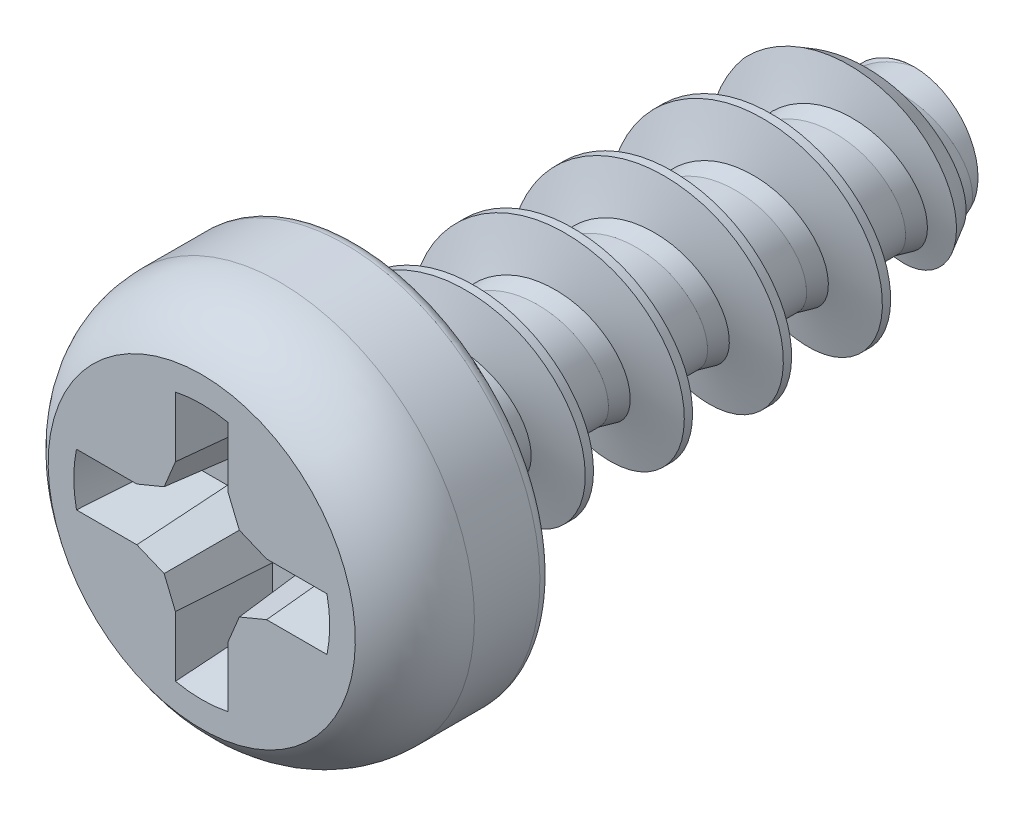
from build123d import *

# Parameters (mm, degrees)
CUT_EXTRUDE1_DEPTH      = 0.8
CIRPATTERN1_COUNT       = 4
DRAFT2_ANGLE            = 5
FILLET1_R               = 0.11125
SWEEP2_PITCH            = 0.89
CUT_EXTRUDE4_DEPTH      = 7.947736046
CUT_EXTRUDE4_DEPTH_BACK = 7.947736046
SKETCH16_W              = 1.4
SKETCH16_H              = 3.5
SKETCH16_W_2            = 2.225
SKETCH14_R              = 1
BOSS_EXTRUDE3_DEPTH     = 0.25
SKETCH15_R              = 1
BOSS_EXTRUDE4_DEPTH     = 0.75
BOSS_EXTRUDE4_DRAFT     = -39


# Read off the part's stored shape, not the designer's step: Draft1
with BuildPart() as part:
    # Sketch3 → Revolve1 (revolve)
    with BuildSketch(Plane(origin=(0, 0, 0), x_dir=(0, 0, -1), z_dir=(1, 0, 0)), mode=Mode.PRIVATE) as revolve1_sk:
        Polygon((0, 0.575), (0, 1.75), (-1.4, 1.75), (-1.4, 0), (5, 0), (5, 0.575), align=None)
    revolve(revolve1_sk.sketch.rotate(Axis((0, 0, 1.4), (0, 0, -1)), 180), axis=Axis((0, 0, 1.4), (0, 0, -1)))

    # Sketch4 → Cut-Revolve1 (revolve, cut)
    with BuildSketch(Plane(origin=(0, 0, 0), x_dir=(0, 0, -1), z_dir=(1, 0, 0)), mode=Mode.PRIVATE) as cut_revolve1_sk:
        with BuildLine():
            Line((-1.4, 1.38), (-1.6, 1.38))
            Line((-1.6, 1.38), (-1.6, 1.95))
            Line((-1.6, 1.95), (0, 1.95))
            Line((0, 1.95), (0, 1.75))
            Line((0, 1.75), (-0.7, 1.75))
            ThreePointArc((-0.7, 1.75), (-1.095885084, 1.651809619), (-1.4, 1.38))
        make_face()
    revolve(cut_revolve1_sk.sketch.rotate(Axis((0, 0, 0), (0, 0, 1)), 180), axis=Axis((0, 0, 0), (0, 0, 1)), mode=Mode.SUBTRACT)

    # Sketch5 → Cut-Extrude1 (cut)
    with BuildSketch(Plane.XY.offset(1.4)):
        with BuildLine():
            Line((0, 1.15), (0, 0))
            Line((0, 0), (1.15, 0))
            ThreePointArc((1.15, 0), (1.146975915, 0.083344165), (1.137919565, 0.16625))
            Line((1.137919565, 0.16625), (0.568959783, 0.16625))
            Line((0.568959783, 0.16625), (0.284200965, 0.284200965))
            Line((0.284200965, 0.284200965), (0.16625, 0.568959783))
            Line((0.16625, 0.568959783), (0.16625, 1.137919565))
            ThreePointArc((0.16625, 1.137919565), (0.083344165, 1.146975915), (0, 1.15))
        make_face()
    cut_extrude1 = extrude(amount=-CUT_EXTRUDE1_DEPTH, mode=Mode.SUBTRACT)

    # CirPattern1: Cut-Extrude1 ×4 about axis
    cirpattern1_axis = Axis((0, 0, 0), (0, 0, 1))
    for i in range(1, CIRPATTERN1_COUNT):
        add(cut_extrude1.rotate(cirpattern1_axis, i * 360 / CIRPATTERN1_COUNT), mode=Mode.SUBTRACT)

    # Draft1 outline → Draft1 (revolve)
    with BuildSketch(Plane.XZ):
        Polygon((1.15, 1.4), (1.008938415, 0.6), (1.15, 0.6), align=None)
    revolve(axis=Axis((0, 0, 0), (0, 0, 1)))

    # Draft2
    draft2_faces = [part.faces().sort_by_distance(p)[0] for p in [
        (0.16625, 0.819472282, 1.019127298),
        (0.225225482, 0.426580374, 1),
        (0.426580374, 0.225225482, 1),
        (0.819472282, 0.16625, 1.019127298),
        (0.819472282, -0.16625, 1.019127298),
        (0.426580374, -0.225225482, 1),
        (0.225225482, -0.426580374, 1),
        (0.16625, -0.819472282, 1.019127298),
        (-0.16625, -0.819472282, 1.019127298),
        (-0.225225482, -0.426580374, 1),
        (-0.426580374, -0.225225482, 1),
        (-0.819472282, -0.16625, 1.019127298),
        (-0.819472282, 0.16625, 1.019127298),
        (-0.426580374, 0.225225482, 1),
        (-0.225225482, 0.426580374, 1),
        (-0.16625, 0.819472282, 1.019127298),
    ]]
    draft(draft2_faces, Plane.XY.offset(0.6), DRAFT2_ANGLE)

    # Fillet1
    fillet1_edges = [part.edges().sort_by_distance(p)[0] for p in [
        (0, 1.75, 0),
    ]]
    fillet(fillet1_edges, radius=FILLET1_R)


with BuildPart() as body_2:
    # Split1: the piece on the far side of the plane
    add(part.part)
    split(bisect_by=Plane.XY, keep=Keep.BOTTOM)

    # Sweep2: the profile of Sketch9 screwed along a right-hand helix of 7.617978 turns, 8 arcs to a turn; built about Z, then put on its axis
    sweep2_z = Axis((0, 0, 0), (0, 0, 1))
    sweep2_corners = [(1, 0, -0.263915531), (1, 0, -0.338082198), (0.612083333, 0, -0.442024155), (0.575, 0, -0.601997729), (0.421928043, 0, -0.601997729), (0.421928043, 0, 0), (0.575, 0, 0), (0.612083333, 0, -0.159973574)]
    with BuildLine(mode=Mode.PRIVATE) as sweep2_profile:
        Line(sweep2_corners[0], sweep2_corners[1])
        Line(sweep2_corners[1], sweep2_corners[2])
        Line(sweep2_corners[2], sweep2_corners[3])
        Line(sweep2_corners[3], sweep2_corners[4])
        Line(sweep2_corners[4], sweep2_corners[5])
        Line(sweep2_corners[5], sweep2_corners[6])
        Line(sweep2_corners[6], sweep2_corners[7])
        Line(sweep2_corners[7], sweep2_corners[0])
    sweep2_cap = Face(sweep2_profile.wire())
    sweep2_turn_angles = [0, 22.5, 45, 67.5, 90, 112.5, 135, 157.5, 180, 202.5, 225, 247.5, 270, 292.5, 315, 337.5, 360]
    sweep2_turn_weights = [1, 0.9238795325112867, 1, 0.9238795325112867, 1, 0.9238795325112867, 1, 0.9238795325112867, 1, 0.9238795325112867, 1, 0.9238795325112867, 1, 0.9238795325112867, 1, 0.9238795325112867, 1]
    sweep2_turn_rails = [Edge.make_bspline([Vector(p[0], p[1], 0).rotate(sweep2_z, sweep2_turn_angles[k]) / sweep2_turn_weights[k] + Vector(0, 0, p[2] + SWEEP2_PITCH * sweep2_turn_angles[k] / 360) for k in range(17)], [0, 0, 0, 1, 1, 2, 2, 3, 3, 4, 4, 5, 5, 6, 6, 7, 7, 8, 8, 8], 2, sweep2_turn_weights) for p in sweep2_corners]
    sweep2_turn_sides = [Face.make_surface_from_curves(sweep2_turn_rails[p[0]], sweep2_turn_rails[p[1]]) for p in [(0, 1), (1, 2), (2, 3), (3, 4), (4, 5), (5, 6), (6, 7), (7, 0)]]
    sweep2_last_angles = [2520, 2542.5, 2565, 2587.5, 2610, 2632.5, 2655, 2677.5, 2700, 2721.235955056, 2742.471910112]
    sweep2_last_weights = [1, 0.9238795325112867, 1, 0.9238795325112867, 1, 0.9238795325112867, 1, 0.9238795325112867, 1, 0.9320966859023876, 1]
    sweep2_last_rails = [Edge.make_bspline([Vector(p[0], p[1], 0).rotate(sweep2_z, sweep2_last_angles[k]) / sweep2_last_weights[k] + Vector(0, 0, p[2] + SWEEP2_PITCH * sweep2_last_angles[k] / 360) for k in range(11)], [0, 0, 0, 1, 1, 2, 2, 3, 3, 4, 4, 5, 5, 5], 2, sweep2_last_weights) for p in sweep2_corners]
    sweep2_last_sides = [Face.make_surface_from_curves(sweep2_last_rails[p[0]], sweep2_last_rails[p[1]]) for p in [(0, 1), (1, 2), (2, 3), (3, 4), (4, 5), (5, 6), (6, 7), (7, 0)]]
    sweep2 = Plane(origin=(0, 0, -5.89), x_dir=(0, 1, 0), z_dir=(0, 0, 1)) * Solid(Shell([*[p.moved(Location((0, 0, SWEEP2_PITCH * i))) for i in range(7) for p in sweep2_turn_sides], *sweep2_last_sides, sweep2_cap, sweep2_cap.rotate(sweep2_z, 2742.471910112).moved(Location((0, 0, SWEEP2_PITCH * 2742.471910112 / 360)))]))
    add(sweep2)

    # Sketch16 → Cut-Extrude4 (cut, two sides: drawn at the far end of the back side and taken through both)
    with BuildSketch(Plane(origin=(0, 0, 0), x_dir=(0, 0, -1), z_dir=(1, 0, 0)).offset(-CUT_EXTRUDE4_DEPTH_BACK)):
        with Locations((-0.7, 0)):
            Rectangle(SKETCH16_W, SKETCH16_H)
        with Locations((6.1125, 0)):
            Rectangle(SKETCH16_W_2, SKETCH16_H)
    extrude(amount=CUT_EXTRUDE4_DEPTH + CUT_EXTRUDE4_DEPTH_BACK, mode=Mode.SUBTRACT)

    # Sketch13 → Cut-Revolve2 (revolve, cut)
    with BuildSketch(Plane(origin=(0, 0, 0), x_dir=(0, 0, -1), z_dir=(1, 0, 0))):
        Polygon((5, 1.75), (5, 0.575), (2.923194531, 1.75), align=None)
    revolve(axis=Axis((0, 0, 0), (0, 0, -1)), mode=Mode.SUBTRACT)


with BuildPart() as part_1:
    add(part.part)

    # Split1
    split(bisect_by=Plane.XY, keep=Keep.TOP)

    add(body_2.part)  # Boss-Extrude3 merges body 2
    # Sketch14 → Boss-Extrude3 (add)
    with BuildSketch(Plane.XY):
        Circle(SKETCH14_R)
    extrude(amount=-BOSS_EXTRUDE3_DEPTH)


with BuildPart() as boss_extrude4_tool:
    # Sketch15 → Boss-Extrude4 (with draft: the straight prism first)
    with BuildSketch(Plane.XY.offset(-0.25)):
        Circle(SKETCH15_R)
    extrude(amount=-BOSS_EXTRUDE4_DEPTH)
    # Boss-Extrude4: the draft: its side faces are tilted about the plane it starts from
    boss_extrude4_sides = [boss_extrude4_tool.faces().sort_by_distance(p)[0] for p in [
        (-1, 0, -0.625),
    ]]
    draft(boss_extrude4_sides, Plane.XY.offset(-0.25), BOSS_EXTRUDE4_DRAFT)


with BuildPart() as part_2:
    add(part_1.part)

    # Boss-Extrude4: add boss_extrude4_tool
    add(boss_extrude4_tool.part)


solid = part_2.part
